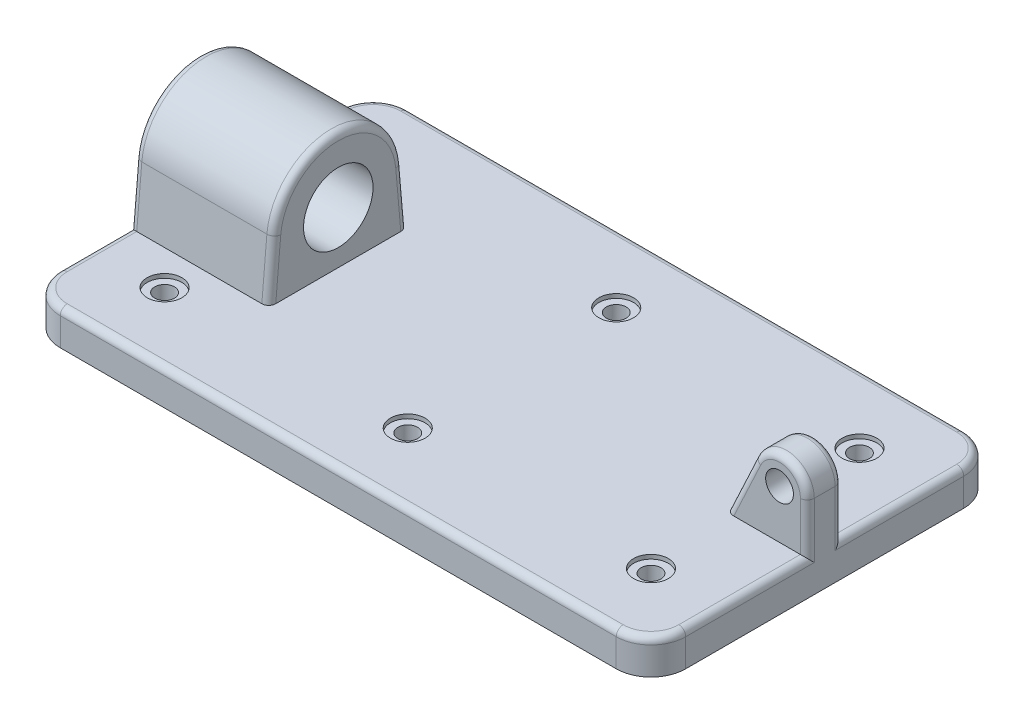
from build123d import *

# Parameters (mm, degrees)
SKETCH1_W                      = 114.3
SKETCH1_H                      = 6.35
BASE_EXTRUDE_DEPTH             = 31.75
FILLET1_START                  = -3.175
FILLET1_DEPTH                  = 6.35
FILLET1_2_DEPTH                = 25.4
FILLET1_START_2                = -1
FILLET1_3_DEPTH                = 7.35
LEVER_BOSS_DEPTH               = 25.4
LEVER_BOSS_2_OUTLINE_W         = 6.35
LEVER_BOSS_2_OUTLINE_H         = 63.5
LEVER_BOSS_2_DEPTH             = 114.3
BOSS_EXTRUDE2_DEPTH            = 25.4
HOLE1_START                    = -1
HOLE1_DEPTH                    = 16.24
HOLE1_START_2                  = -3.175
HOLE1_2_OUTLINE_R              = 2.54
HOLE1_2_DEPTH                  = 6.35
HOLE2_D                        = 12.7
HOLE2_DEPTH                    = 25.4
F_4_SPOTFACE_HOLE1_D           = 3.6068
F_4_SPOTFACE_HOLE1_CBORE_D     = 6.35
F_4_SPOTFACE_HOLE1_CBORE_DEPTH = 0.762
LPATTERN1_COUNT                = 3
LPATTERN1_PITCH                = 44.45
LPATTERN1_COUNT_DIR2           = 2
LPATTERN1_PITCH_DIR2           = 38.1
FILLET2_R                      = 1.27


with BuildPart() as part:
    # Sketch1 → Base-Extrude (new, symmetric)
    with BuildSketch(Plane.XY):
        with Locations((57.15, 3.175)):
            Rectangle(SKETCH1_W, SKETCH1_H)
    extrude(amount=BASE_EXTRUDE_DEPTH, both=True)

    # Fillet1: read off the stored shape, not the designer's step
    # Fillet1 outline → Fillet1 (add)
    with BuildSketch(Plane.XY.offset(FILLET1_START)):
        with BuildLine():
            ThreePointArc((114.3, 15.24), (110.319513239, 20.199583716), (104.615956442, 17.38690077))
            Line((104.615956442, 17.38690077), (99.469365091, 6.35))
            Line((99.469365091, 6.35), (114.3, 6.35))
            Line((114.3, 6.35), (114.3, 15.24))
        make_face()
    extrude(amount=FILLET1_DEPTH)

    # Fillet1 2 outline → Fillet1 2 (add)
    with BuildSketch(Plane.YZ):
        with BuildLine():
            Line((6.35, -12.7), (16.905312852, -11.776529785))
            ThreePointArc((16.905312852, -11.776529785), (27.696514216, 0), (16.905312852, 11.776529785))
            Line((16.905312852, 11.776529785), (6.35, 12.7))
            Line((6.35, 12.7), (6.35, -12.7))
        make_face()
    extrude(amount=FILLET1_2_DEPTH)

    # Fillet1 3 outline → Fillet1 3 (cut)
    with BuildSketch(Plane(origin=(0, 0, 0), x_dir=(1, 0, 0), z_dir=(0, 1, 0)).offset(FILLET1_START_2)):
        with BuildLine():
            ThreePointArc((0, 25.4), (1.859871939, 29.890128061), (6.35, 31.75))
            Line((6.35, 31.75), (0, 31.75))
            Line((0, 31.75), (0, 25.4))
        make_face()
        with BuildLine():
            Line((114.3, 31.75), (107.95, 31.75))
            ThreePointArc((107.95, 31.75), (112.440128061, 29.890128061), (114.3, 25.4))
            Line((114.3, 25.4), (114.3, 31.75))
        make_face()
        with BuildLine():
            ThreePointArc((6.35, -31.75), (1.859871939, -29.890128061), (0, -25.4))
            Line((0, -25.4), (0, -31.75))
            Line((0, -31.75), (6.35, -31.75))
        make_face()
        with BuildLine():
            ThreePointArc((114.3, -25.4), (112.440128061, -29.890128061), (107.95, -31.75))
            Line((107.95, -31.75), (114.3, -31.75))
            Line((114.3, -31.75), (114.3, -25.4))
        make_face()
    extrude(amount=FILLET1_3_DEPTH, mode=Mode.SUBTRACT)

    # lever boss: read off the stored shape, not the designer's step
    # lever boss outline → lever boss (cut)
    with BuildSketch(Plane.YZ):
        with BuildLine():
            Line((16.905312852, 11.776529785), (6.35, 12.7))
            Line((6.35, 12.7), (6.35, -12.7))
            Line((6.35, -12.7), (16.905312852, -11.776529785))
            ThreePointArc((16.905312852, -11.776529785), (27.696514216, 0), (16.905312852, 11.776529785))
        make_face()
    extrude(amount=LEVER_BOSS_DEPTH, mode=Mode.SUBTRACT)

    # lever boss 2 outline → lever boss 2 (add)
    with BuildSketch(Plane.YZ):
        with Locations((3.175, 0)):
            Rectangle(LEVER_BOSS_2_OUTLINE_W, LEVER_BOSS_2_OUTLINE_H)
    extrude(amount=LEVER_BOSS_2_DEPTH)

    # Sketch3 → Boss-Extrude2 (add)
    with BuildSketch(Plane.ZY):
        with BuildLine():
            Line((12.7, 6.35), (11.776529785, 16.905312852))
            ThreePointArc((11.776529785, 16.905312852), (0, 27.696514216), (-11.776529785, 16.905312852))
            Line((-11.776529785, 16.905312852), (-12.7, 6.35))
            Line((-12.7, 6.35), (12.7, 6.35))
        make_face()
    extrude(amount=-BOSS_EXTRUDE2_DEPTH)

    # Hole1: read off the stored shape, not the designer's step
    # Hole1 outline → Hole1 (cut)
    with BuildSketch(Plane(origin=(0, 0, 0), x_dir=(1, 0, 0), z_dir=(0, 1, 0)).offset(HOLE1_START)):
        with BuildLine():
            ThreePointArc((0, 25.4), (1.859871939, 29.890128061), (6.35, 31.75))
            Line((6.35, 31.75), (0, 31.75))
            Line((0, 31.75), (0, 25.4))
        make_face()
        with BuildLine():
            Line((114.3, 31.75), (107.95, 31.75))
            ThreePointArc((107.95, 31.75), (112.440128061, 29.890128061), (114.3, 25.4))
            Line((114.3, 25.4), (114.3, 31.75))
        make_face()
        with BuildLine():
            ThreePointArc((6.35, -31.75), (1.859871939, -29.890128061), (0, -25.4))
            Line((0, -25.4), (0, -31.75))
            Line((0, -31.75), (6.35, -31.75))
        make_face()
        with BuildLine():
            ThreePointArc((114.3, -25.4), (112.440128061, -29.890128061), (107.95, -31.75))
            Line((107.95, -31.75), (114.3, -31.75))
            Line((114.3, -31.75), (114.3, -25.4))
        make_face()
    extrude(amount=HOLE1_DEPTH, mode=Mode.SUBTRACT)

    # Hole1 2 outline → Hole1 2 (cut)
    with BuildSketch(Plane.XY.offset(HOLE1_START_2)):
        with Locations((109.22, 15.24)):
            Circle(HOLE1_2_OUTLINE_R)
    extrude(amount=HOLE1_2_DEPTH, mode=Mode.SUBTRACT)

    # Hole2
    with Locations(Plane(origin=(25.4, 3.190032044, 95.175064019), x_dir=(0, 0, -1), z_dir=(1, 0, 0))):
        with Locations((95.175064019, 12.684967956)):
            Hole(HOLE2_D / 2, depth=HOLE2_DEPTH)

    # #4 spotface hole1 (through all)
    with Locations(Plane(origin=(72.288522493, 6.35, 6.630777087), x_dir=(-1, 0, 0), z_dir=(0, 1, 0))):
        with Locations((-29.311477507, 12.419222913)):
            f_4_spotface_hole1 = CounterBoreHole(F_4_SPOTFACE_HOLE1_D / 2, F_4_SPOTFACE_HOLE1_CBORE_D / 2, F_4_SPOTFACE_HOLE1_CBORE_DEPTH)

    # LPattern1: 4 spotface hole1 3 × 2
    with Locations(*[(-i * LPATTERN1_PITCH, 0, -j * LPATTERN1_PITCH_DIR2) for i in range(LPATTERN1_COUNT) for j in range(LPATTERN1_COUNT_DIR2) if (i, j) != (0, 0)]):
        add(f_4_spotface_hole1, mode=Mode.SUBTRACT)

    # Fillet2
    fillet2_edges = [part.edges().sort_by_distance(p)[0] for p in [
        (114.3, 6.35, -14.2875),
        (114.3, 10.795, -3.175),
        (110.319513239, 20.199583716, -3.175),
        (102.042660767, 11.868450385, -3.175),
        (114.3, 10.795, 3.175),
        (110.319513239, 20.199583716, 3.175),
        (102.042660767, 11.868450385, 3.175),
        (0, 6.35, -19.05),
        (0, 11.627656426, -12.238264893),
        (0, 27.696514216, 0),
        (25.4, 11.627656426, 12.238264893),
        (25.4, 11.627656426, -12.238264893),
        (25.4, 27.696514216, 0),
        (0, 11.627656426, 12.238264893),
        (57.15, 6.35, -31.75),
        (57.15, 6.35, 31.75),
        (112.440128061, 6.35, -29.890128061),
        (112.440128061, 6.35, 29.890128061),
        (1.859871939, 6.35, 29.890128061),
        (1.859871939, 6.35, -29.890128061),
    ]]
    fillet(fillet2_edges, radius=FILLET2_R)


solid = part.part
